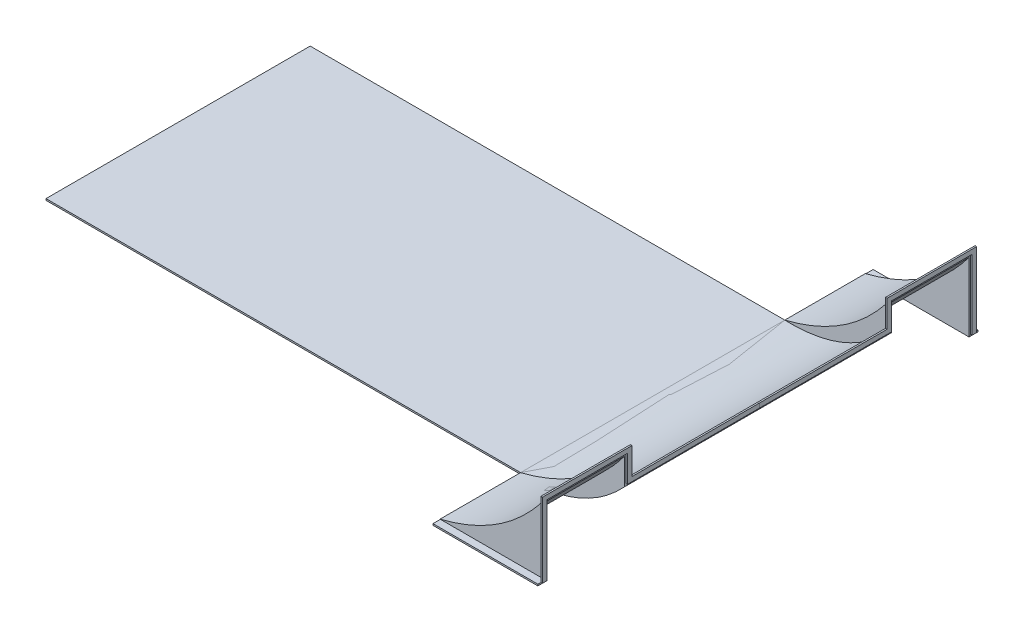
from build123d import *

# Parameters (mm, degrees)
SKETCH1_W            = 1060
SKETCH1_H            = 590
BOSS_EXTRUDE1_DEPTH  = 3.5
EXTRUDE_THIN1_START  = -590
EXTRUDE_THIN1_DEPTH  = 590
EXTRUDE_THIN2_DEPTH  = 180
EXTRUDE_THIN3_REACH  = 1162.405
SKETCH11_W           = 236.744190684
SKETCH11_H           = 3.5
EXTRUDE_THIN4_REACH  = 1162.405
SKETCH13_W           = 235
SKETCH13_H           = 3.5
CUT_EXTRUDE1_START   = -950
SKETCH18_W           = 9.295788825
SKETCH18_H           = 156.5
CUT_EXTRUDE1_DEPTH   = 950
CUT_EXTRUDE2_DEPTH   = 35.5
BOSS_EXTRUDE9_DEPTH  = 3.5
SKETCH27_W           = 20
SKETCH27_H           = 3.5
BOSS_EXTRUDE10_DEPTH = 234.162052
SKETCH31_W           = 516.811278328
SKETCH31_H           = 219.504039685
CUT_EXTRUDE7_DEPTH   = 190.5
CUT_EXTRUDE8_START   = -1295
SKETCH32_W           = 505.926906796
SKETCH32_H           = 339.060315412
CUT_EXTRUDE8_DEPTH   = 1295


# Read off the part's stored shape, not the designer's step: Extrude-Thin1, Extrude-Thin2
with BuildPart() as part:
    # Sketch1 → Boss-Extrude1 (new body)
    with BuildSketch(Plane(origin=(0, 0, 0), x_dir=(1, 0, 0), z_dir=(0, 1, 0))):
        with Locations((273.370786517, -12.790262172)):
            Rectangle(SKETCH1_W, SKETCH1_H)
    extrude(amount=-BOSS_EXTRUDE1_DEPTH)

    # Extrude-Thin1 outline → Extrude-Thin1 (add)
    with BuildSketch(Plane.XY.offset(307.790262172).offset(EXTRUDE_THIN1_START)):
        with BuildLine():
            Line((803.370786517, -3.5), (803.313227264, -3.5))
            add(Edge.make_bspline(
                [(803.313227264, -3.5), (827.239281851, -4.28540716), (850.150849594, -2.84924817), (893.9422698, 4.489313064), (914.820042541, 10.395966502), (954.483208023, 26.683181264), (973.267586216, 37.063539809), (1008.708428447, 62.273168795), (1025.364681446, 77.101551974), (1040.952925263, 94.13725594)],
                knots=[0.000201097, 0.000201097, 0.000201097, 0.000201097, 0.25, 0.25, 0.5, 0.5, 0.75, 0.75, 1, 1, 1, 1], degree=3))
            Line((1040.952925263, 94.13725594), (1038.370786517, 96.5))
            add(Edge.make_bspline(
                [(803.370786517, 0), (945.773453098, -4.695540598), (1038.370786517, 96.5)],
                knots=[0, 0, 0, 1, 1, 1], degree=2))
            Line((803.370786517, 0), (803.370786517, -3.5))
        make_face()
    extrude(amount=EXTRUDE_THIN1_DEPTH)

    # Extrude-Thin2 outline → Extrude-Thin2 (add)
    with BuildSketch(Plane.XY.offset(307.790262172)):
        with BuildLine():
            Line((803.370786517, 0), (804.208734579, -3.398211742))
            add(Edge.make_bspline(
                [(804.208734579, -3.398211742), (829.067667959, 2.73162849), (852.660481385, 10.617424921), (897.298530323, 29.90649551), (918.34352591, 41.30991081), (957.865744307, 67.630026466), (976.342654863, 82.546590392), (1010.7128816, 115.877947479), (1026.606120018, 134.292434803), (1041.205275081, 154.446789202)],
                knots=[0, 0, 0, 0, 0.25, 0.25, 0.5, 0.5, 0.75, 0.75, 1, 1, 1, 1], degree=3))
            Line((1041.205275081, 154.446789202), (1038.370786517, 156.5))
            add(Edge.make_bspline(
                [(803.370786517, 0), (951.458443478, 36.516195756), (1038.370786517, 156.5)],
                knots=[0, 0, 0, 1, 1, 1], degree=2))
        make_face()
    extrude_thin2 = extrude(amount=EXTRUDE_THIN2_DEPTH)

    # Sketch11 → Extrude-Thin3 (add, up to next)
    with BuildSketch(Plane(origin=(0, 0, 0), x_dir=(1, 0, 0), z_dir=(0, 1, 0)), mode=Mode.PRIVATE) as extrude_thin3_sk1:
        with Locations((922.580829921, -309.540262172)):
            Rectangle(SKETCH11_W, SKETCH11_H)
    extrude_thin3_tool1 = extrude(extrude_thin3_sk1.sketch, amount=EXTRUDE_THIN3_REACH, mode=Mode.PRIVATE) - part.part
    extrude_thin3 = extrude_thin3_tool1.solids().sort_by_distance((922.58083, 0, 309.540262))[0]
    add(extrude_thin3)

    # Sketch13 → Extrude-Thin4 (add, up to next)
    with BuildSketch(Plane(origin=(0, 0, 0), x_dir=(1, 0, 0), z_dir=(0, 1, 0)), mode=Mode.PRIVATE) as extrude_thin4_sk1:
        with Locations((920.870786517, -486.040262172)):
            Rectangle(SKETCH13_W, SKETCH13_H)
    extrude_thin4_tool1 = extrude(extrude_thin4_sk1.sketch, amount=EXTRUDE_THIN4_REACH, mode=Mode.PRIVATE) - part.part
    extrude_thin4 = extrude_thin4_tool1.solids().sort_by_distance((920.870787, 0, 486.040262))[0]
    add(extrude_thin4)

    # Mirror1: Extrude-Thin2, Extrude-Thin3, Extrude-Thin4 across plane
    add(extrude_thin2.mirror(Plane.XY.offset(12.790262172)))
    add(extrude_thin3.mirror(Plane.XY.offset(12.790262172)))
    add(extrude_thin4.mirror(Plane.XY.offset(12.790262172)))

    # Sketch18 → Cut-Extrude1 (cut)
    with BuildSketch(Plane.XY.offset(487.790262172).offset(CUT_EXTRUDE1_START)):
        with Locations((1043.01868093, 78.25)):
            Rectangle(SKETCH18_W, SKETCH18_H)
    extrude(amount=CUT_EXTRUDE1_DEPTH, mode=Mode.SUBTRACT)

    # Sketch23 → Cut-Extrude2 (cut)
    with BuildSketch(Plane(origin=(0, 0, 307.790262172), x_dir=(-1, 0, 0), z_dir=(0, 0, -1))):
        with BuildLine():
            add(Edge.make_bspline(
                [(-866.890762603, 0), (-868.612672192, 0.259242322), (-870.328336217, 0.532092751), (-893.9422698, 4.489313064), (-914.820042541, 10.395966502), (-954.483208023, 26.683181264), (-973.267586216, 37.063539809), (-1007.733659748, 61.579800475), (-1023.528999951, 75.476914558), (-1038.370786517, 91.345985167)],
                knots=[0.230490173, 0.230490173, 0.230490173, 0.230490173, 0.25, 0.25, 0.5, 0.5, 0.75, 0.75, 0.986247947, 0.986247947, 0.986247947, 0.986247947], degree=3))
            Line((-1038.370786517, 91.345985167), (-1038.370786517, 0))
            Line((-1038.370786517, 0), (-866.890762603, 0))
        make_face()
    cut_extrude2 = extrude(amount=-CUT_EXTRUDE2_DEPTH, mode=Mode.SUBTRACT)

    # Mirror2: Cut-Extrude2 across plane
    add(cut_extrude2.mirror(Plane.XY.offset(12.790262172)), mode=Mode.SUBTRACT)

    # Sketch27 → Boss-Extrude10 (add)
    with BuildSketch(Plane(origin=(1038.370786517, 0, 0), x_dir=(0, 0, -1), z_dir=(1, 0, 0))):
        with Locations((-494.290262172, -1.75)):
            Rectangle(SKETCH27_W, SKETCH27_H)
    extrude(amount=-BOSS_EXTRUDE10_DEPTH)

    # Sketch32 → Cut-Extrude8 (cut)
    with BuildSketch(Plane(origin=(1038.370786517, 0, 0), x_dir=(0, 0, -1), z_dir=(1, 0, 0)).offset(CUT_EXTRUDE8_START)):
        with Locations((240.173191226, 40.919391946)):
            Rectangle(SKETCH32_W, SKETCH32_H)
    extrude(amount=CUT_EXTRUDE8_DEPTH, mode=Mode.SUBTRACT)

    # Mirror12: part across plane


with BuildPart() as body_2:
    # Sketch24 → Boss-Extrude9 (new body)
    with BuildSketch(Plane(origin=(1038.370786517, 0, 0), x_dir=(0, 0, -1), z_dir=(1, 0, 0))):
        Polygon((-497.790262172, 166.5), (-297.790262172, 166.5), (-297.790262172, 106.5), (272.209737828, 106.5), (272.209737828, 166.5), (472.209737828, 166.5), (472.209737828, -0.060643547), (462.209737828, 0), (462.209737828, 156.5), (282.209737828, 156.5), (282.209737828, 96.5), (-307.790262172, 96.5), (-307.790262172, 156.5), (-487.790262172, 156.5), (-487.790262172, 0), (-497.790262172, 0), align=None)
    extrude(amount=BOSS_EXTRUDE9_DEPTH)

    # Sketch31 → Cut-Extrude7 (cut)
    with BuildSketch(Plane(origin=(1038.370786517, 0, 0), x_dir=(0, 0, -1), z_dir=(1, 0, 0))):
        with Locations((245.615376992, 106.252019843)):
            Rectangle(SKETCH31_W, SKETCH31_H)
    extrude(amount=CUT_EXTRUDE7_DEPTH, mode=Mode.SUBTRACT)


with BuildPart() as part_1:
    add(part.part)
    add(part.part.mirror(Plane.XY.offset(12.790262172)))


with BuildPart() as body_3:
    # Mirror13: mirrored copy
    add(body_2.part.mirror(Plane.XY.offset(12.790262172)))


with BuildPart() as body_4:
    # Mirror13 2: mirrored copy
    add(part_1.part.mirror(Plane.XY.offset(12.790262172)))


solid = Compound([body_2.part, part_1.part, body_3.part, body_4.part])
